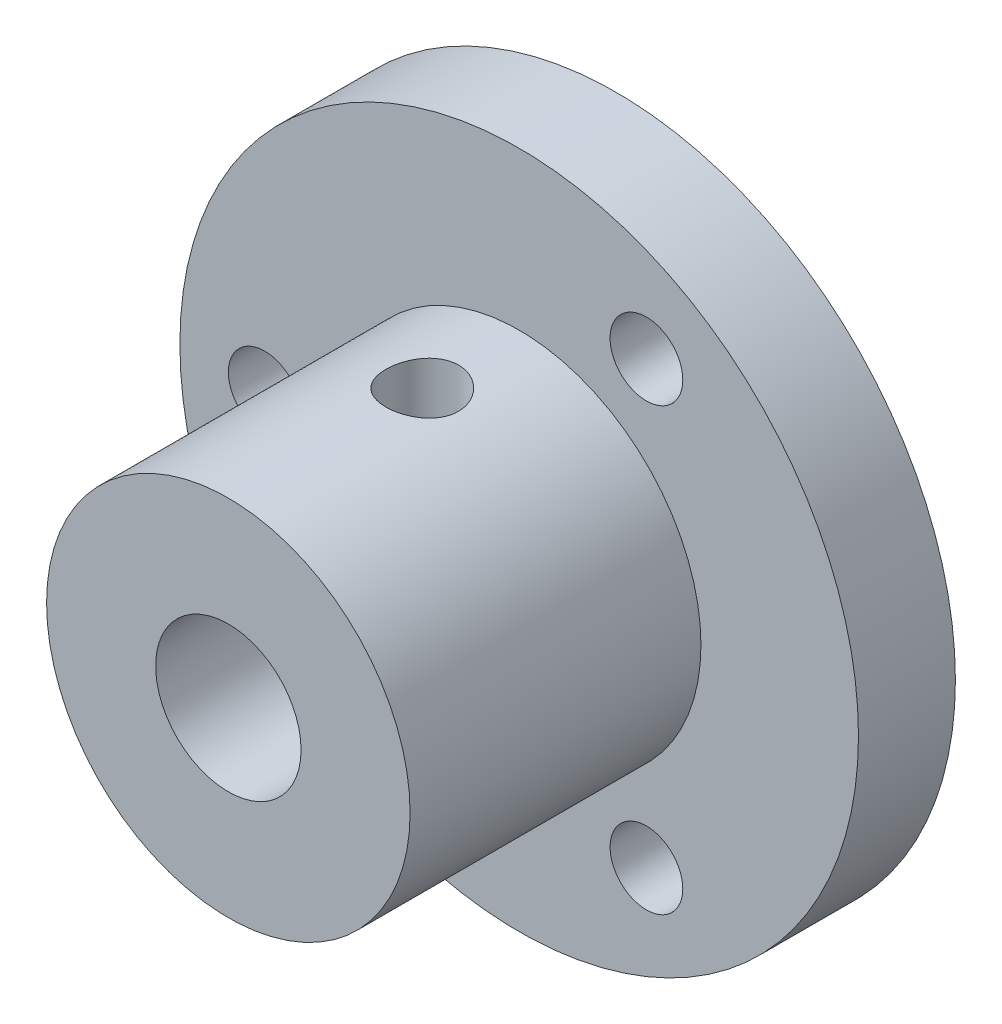
from build123d import *

# Parameters (mm, degrees)
SKETCH_1_R               = 14
SKETCH_1_R_2             = 1.5
SKETCH_1_R_3             = 3
EXTRUDE_1_DEPTH          = 4
SKETCH_3_R               = 7.5
SKETCH_3_R_2             = 3
EXTRUDE_2_DEPTH          = 12
CUT_EXTRUDE_1_DEPTH      = 26.455844123
CUT_EXTRUDE_1_DEPTH_BACK = 26.455844123
SKETCH_4_R               = 1.5


with BuildPart() as part:
    # ｽｹｯﾁ1 → ﾎﾞｽ - 押し出し1 (new body)
    with BuildSketch(Plane.XY):
        Circle(SKETCH_1_R)
        with Locations((-10.5, 0)):
            Circle(SKETCH_1_R_2, mode=Mode.SUBTRACT)
        with Locations((5.25, -9.09326674)):
            Circle(SKETCH_1_R_2, mode=Mode.SUBTRACT)
        with Locations((5.25, 9.09326674)):
            Circle(SKETCH_1_R_2, mode=Mode.SUBTRACT)
        Circle(SKETCH_1_R_3, mode=Mode.SUBTRACT)
    extrude(amount=EXTRUDE_1_DEPTH)

    # ｽｹｯﾁ3 → ﾎﾞｽ - 押し出し2 (add)
    with BuildSketch(Plane.XY.offset(4)):
        Circle(SKETCH_3_R)
        Circle(SKETCH_3_R_2, mode=Mode.SUBTRACT)
    extrude(amount=EXTRUDE_2_DEPTH)

    # ｽｹｯﾁ4 → ｶｯﾄ - 押し出し1 (cut, two sides: drawn at the far end of the back side and taken through both)
    with BuildSketch(Plane(origin=(0, 0, 0), x_dir=(1, 0, 0), z_dir=(0, 1, 0)).offset(-CUT_EXTRUDE_1_DEPTH_BACK)):
        with Locations((0, -8)):
            Circle(SKETCH_4_R)
    extrude(amount=CUT_EXTRUDE_1_DEPTH + CUT_EXTRUDE_1_DEPTH_BACK, mode=Mode.SUBTRACT)


solid = part.part
